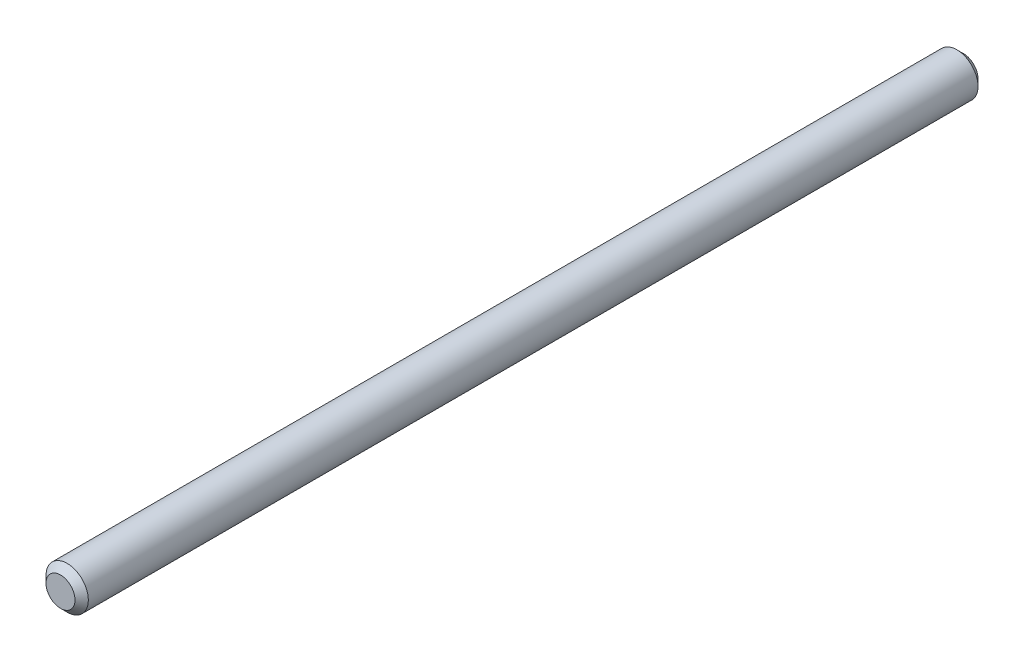
from build123d import *

# Parameters (mm, degrees)
SKETCH1_R           = 3.175
BOSS_EXTRUDE1_DEPTH = 135.470000078
CHAMFER1_SIZE       = 1


with BuildPart() as part:
    # Sketch1 → Boss-Extrude1 (new body)
    with BuildSketch(Plane.XY):
        Circle(SKETCH1_R)
    extrude(amount=-BOSS_EXTRUDE1_DEPTH)

    # Chamfer1
    chamfer1_edges = [part.edges().sort_by_distance(p)[0] for p in [
        (-3.175, 0, -135.470000078),
        (-3.175, 0, 0),
    ]]
    chamfer(chamfer1_edges, length=CHAMFER1_SIZE)


solid = part.part
